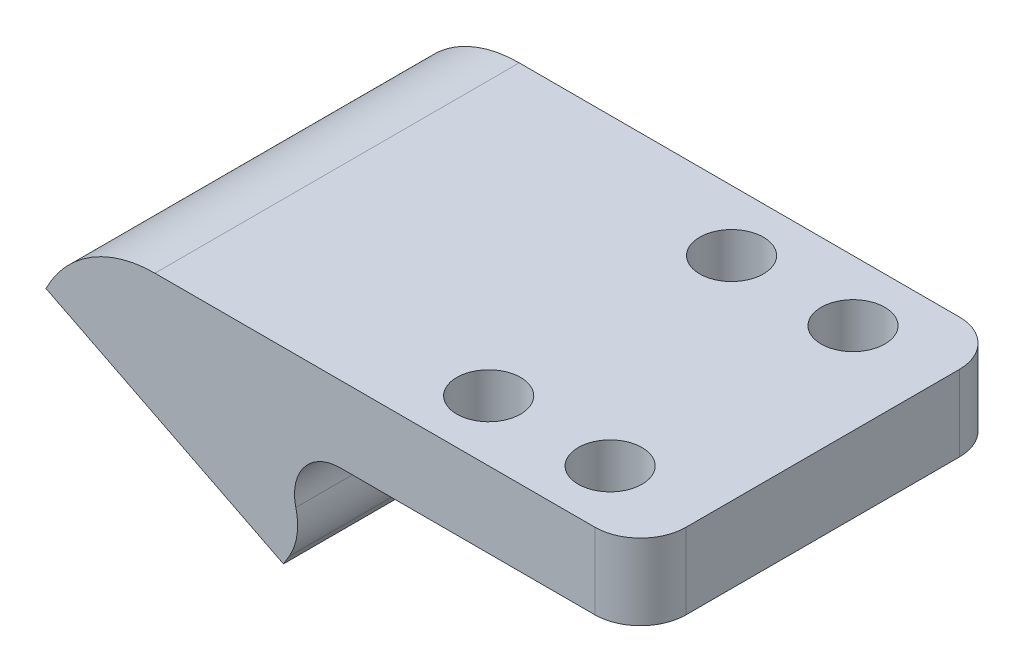
from build123d import *

# Parameters (mm, degrees)
ESQUISSE1_W             = 17
ESQUISSE1_H             = 5
BOSS_EXTRU_1_DEPTH      = 24
BOSS_EXTRU_2_DEPTH      = 24
CONG_1_R                = 4
CONG_2_R                = 8
CONG_3_R                = 3
ESQUISSE3_W             = 24
ESQUISSE3_H             = 5
BOSS_EXTRU_3_DEPTH      = 10
ESQUISSE4_R             = 2.1
ENL_V_MAT_EXTRU_1_DEPTH = 10
CONG_4_R                = 3
ESQUISSE5_R             = 2.25
ENL_V_MAT_EXTRU_2_DEPTH = 3


with BuildPart() as part:
    # Esquisse1 → Boss.-Extru.1 (new body)
    with BuildSketch(Plane.XY):
        with Locations((1.940369129, 2.5)):
            Rectangle(ESQUISSE1_W, ESQUISSE1_H)
    extrude(amount=BOSS_EXTRU_1_DEPTH)

    # Esquisse2 → Boss.-Extru.2 (add)
    with BuildSketch(Plane.XY.offset(24)):
        Polygon((-6.559630871, 0), (-6.559630871, 5), (-16.471058056, 5), (-18.723069156, 0.535871193), (-3.080508445, -7.355303518), (-0.501566554, -3.056100904), align=None)
    extrude(amount=-BOSS_EXTRU_2_DEPTH)

    # Congé1
    cong_1_edges = [part.edges().sort_by_distance(p)[0] for p in [
        (-0.501566554, -3.056100904, 12),
    ]]
    fillet(cong_1_edges, radius=CONG_1_R)

    # Congé2
    cong_2_edges = [part.edges().sort_by_distance(p)[0] for p in [
        (-16.471058056, 5, 12),
    ]]
    fillet(cong_2_edges, radius=CONG_2_R)

    # Congé3
    cong_3_edges = [part.edges().sort_by_distance(p)[0] for p in [
        (-6.559630871, 0, 12),
    ]]
    fillet(cong_3_edges, radius=CONG_3_R)

    # Esquisse3 → Boss.-Extru.3 (add)
    with BuildSketch(Plane(origin=(10.440369129, 0, 0), x_dir=(0, 0, -1), z_dir=(1, 0, 0))):
        with Locations((-12, 2.5)):
            Rectangle(ESQUISSE3_W, ESQUISSE3_H)
    extrude(amount=BOSS_EXTRU_3_DEPTH)

    # Esquisse4 → Enlèv. mat.-Extru.1 (cut)
    with BuildSketch(Plane(origin=(0, 5, 0), x_dir=(1, 0, 0), z_dir=(0, 1, 0))):
        with Locations((6.440369129, -4)):
            Circle(ESQUISSE4_R)
        with Locations((14.440369129, -4)):
            Circle(ESQUISSE4_R)
        with Locations((6.440369129, -20)):
            Circle(ESQUISSE4_R)
        with Locations((14.440369129, -20)):
            Circle(ESQUISSE4_R)
    extrude(amount=-ENL_V_MAT_EXTRU_1_DEPTH, mode=Mode.SUBTRACT)

    # Congé4
    cong_4_edges = [part.edges().sort_by_distance(p)[0] for p in [
        (20.440369129, 2.5, 0),
        (20.440369129, 2.5, 24),
    ]]
    fillet(cong_4_edges, radius=CONG_4_R)

    # Esquisse5 → Enlèv. mat.-Extru.2 (cut)
    with BuildSketch(Plane(origin=(-3.582711985, -7.101957793, 0), x_dir=(0.892825761431464, -0.45040221993716517, 0), z_dir=(-0.45040221993716517, -0.892825761431464, 0))):
        with Locations((-12.147654158, 8.05)):
            Circle(ESQUISSE5_R)
        with Locations((-12.147654158, 15.95)):
            Circle(ESQUISSE5_R)
        with Locations((-4.247654158, 15.95)):
            Circle(ESQUISSE5_R)
        with Locations((-4.247654158, 8.05)):
            Circle(ESQUISSE5_R)
    extrude(amount=-ENL_V_MAT_EXTRU_2_DEPTH, mode=Mode.SUBTRACT)


solid = part.part
